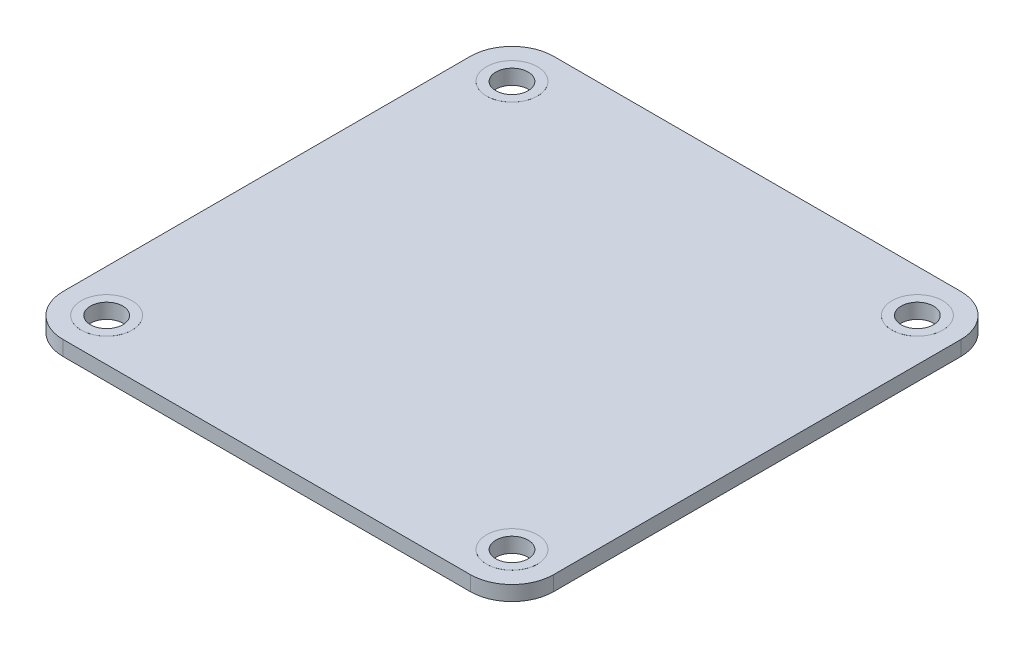
from build123d import *

# Parameters (mm, degrees)
SKETCH1_R           = 1.755
BOSS_EXTRUDE1_DEPTH = 1.6
BOSS_EXTRUDE2_START = 0.8
SKETCH2_R           = 2.75
SKETCH2_R_2         = 1.75
BOSS_EXTRUDE2_DEPTH = 0.805


with BuildPart() as part:
    # Sketch1 → Boss-Extrude1 (new body)
    with BuildSketch(Plane(origin=(0, 0, 0), x_dir=(1, 0, 0), z_dir=(0, 1, 0))):
        with BuildLine():
            Line((22, -26.5), (-22, -26.5))
            ThreePointArc((-22, -26.5), (-25.181980515, -25.181980515), (-26.5, -22))
            Line((-26.5, -22), (-26.5, 22))
            ThreePointArc((-26.5, 22), (-25.181980515, 25.181980515), (-22, 26.5))
            Line((-22, 26.5), (22, 26.5))
            ThreePointArc((22, 26.5), (25.181980515, 25.181980515), (26.5, 22))
            Line((26.5, 22), (26.5, -22))
            ThreePointArc((26.5, -22), (25.181980515, -25.181980515), (22, -26.5))
        make_face()
        with Locations((-21.9, 21.9)):
            Circle(SKETCH1_R, mode=Mode.SUBTRACT)
        with Locations((21.9, 21.9)):
            Circle(SKETCH1_R, mode=Mode.SUBTRACT)
        with Locations((-21.9, -21.9)):
            Circle(SKETCH1_R, mode=Mode.SUBTRACT)
        with Locations((21.9, -21.9)):
            Circle(SKETCH1_R, mode=Mode.SUBTRACT)
    extrude(amount=BOSS_EXTRUDE1_DEPTH)

    # Sketch2 → Boss-Extrude2 (add, symmetric)
    # profile 1 of 4: a face of its own
    with BuildSketch(Plane(origin=(0, 0, 0), x_dir=(1, 0, 0), z_dir=(0, 1, 0)).offset(BOSS_EXTRUDE2_START)):
        with Locations((-21.9, 21.9)):
            Circle(SKETCH2_R)
        with Locations((-21.9, 21.9)):
            Circle(SKETCH2_R_2, mode=Mode.SUBTRACT)
    # profile 2 of 4: a face of its own
    with BuildSketch(Plane(origin=(0, 0, 0), x_dir=(1, 0, 0), z_dir=(0, 1, 0)).offset(BOSS_EXTRUDE2_START)):
        with Locations((21.9, 21.9)):
            Circle(SKETCH2_R)
        with Locations((21.9, 21.9)):
            Circle(SKETCH2_R_2, mode=Mode.SUBTRACT)
    # profile 3 of 4: a face of its own
    with BuildSketch(Plane(origin=(0, 0, 0), x_dir=(1, 0, 0), z_dir=(0, 1, 0)).offset(BOSS_EXTRUDE2_START)):
        with Locations((21.9, -21.9)):
            Circle(SKETCH2_R)
        with Locations((21.9, -21.9)):
            Circle(SKETCH2_R_2, mode=Mode.SUBTRACT)
    # profile 4 of 4: a face of its own
    with BuildSketch(Plane(origin=(0, 0, 0), x_dir=(1, 0, 0), z_dir=(0, 1, 0)).offset(BOSS_EXTRUDE2_START)):
        with Locations((-21.9, -21.9)):
            Circle(SKETCH2_R)
        with Locations((-21.9, -21.9)):
            Circle(SKETCH2_R_2, mode=Mode.SUBTRACT)
    extrude(amount=BOSS_EXTRUDE2_DEPTH, both=True)


solid = part.part
